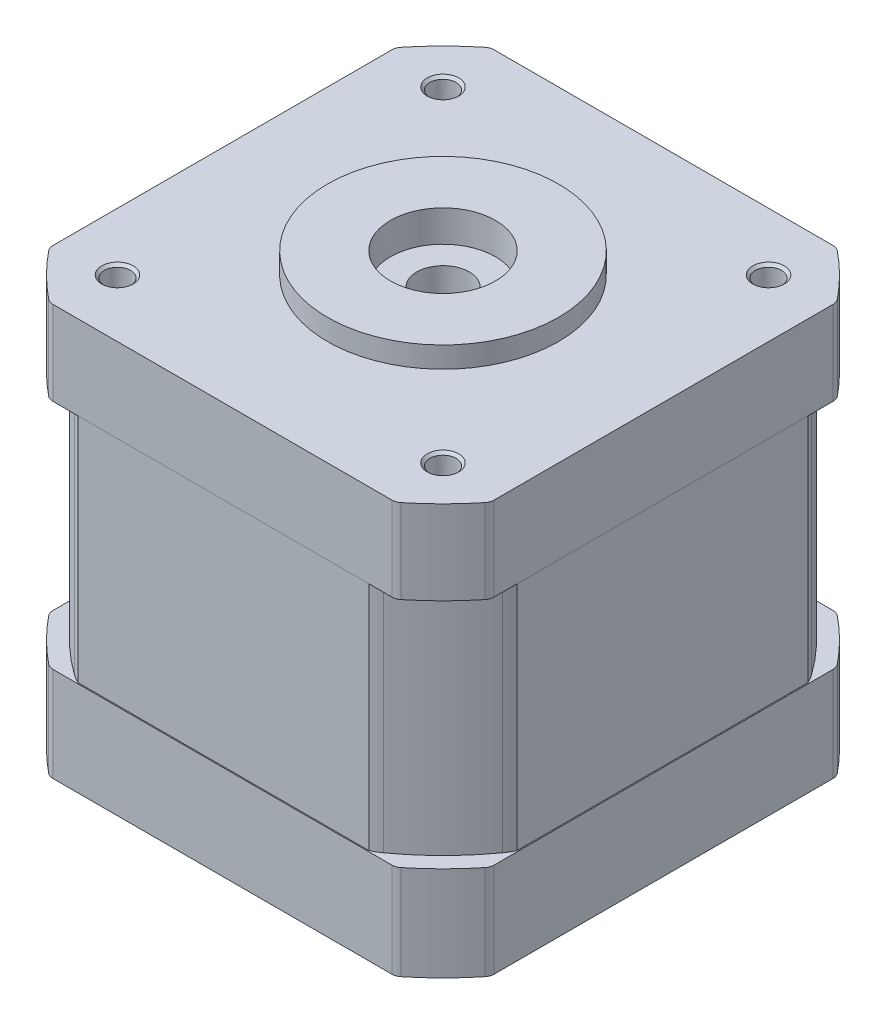
from build123d import *

# Parameters (mm, degrees)
SKETCH2_W          = 55
SKETCH2_H          = 55
SKETCH2_W_2        = 42
SKETCH2_H_2        = 42
CUT_EXTRUDE1_DEPTH = 55.356140408
SKETCH3_W          = 0.1
SKETCH3_H          = 27.678330874
SKETCH3_W_2        = 27.678330874
SKETCH3_H_2        = 0.1
CUT_EXTRUDE2_DEPTH = 22.1
FILLET9_R          = 5
FILLET10_R         = 1
SKETCH4_R          = 1.25
CUT_EXTRUDE3_DEPTH = 6
CHAMFER1_SIZE      = 0.25


with BuildPart() as part:
    # Sketch1 → Revolve1 (revolve)
    with BuildSketch(Plane.XY, mode=Mode.PRIVATE) as revolve1_sk:
        Polygon((5, 0), (11, 0), (11, -2), (26.7, -2), (26.7, -10), (25.15, -10), (25.15, -32.1), (26.7, -32.1), (26.7, -41.1), (5, -41.1), (5, -38.1), (2.5, -38.1), (2.5, -32.1), (11, -32.1), (11, -10), (2.5, -10), (2.5, -3), (5, -3), align=None)
    revolve(revolve1_sk.sketch.rotate(Axis((0, 0, 0), (0, -1, 0)), 180), axis=Axis((0, 0, 0), (0, -1, 0)))

    # Sketch2 → Cut-Extrude1 (cut, through all)
    with BuildSketch(Plane(origin=(0, -2, 0), x_dir=(1, 0, 0), z_dir=(0, 1, 0))):
        Rectangle(SKETCH2_W, SKETCH2_H)
        Rectangle(SKETCH2_W_2, SKETCH2_H_2, mode=Mode.SUBTRACT)
    extrude(amount=-CUT_EXTRUDE1_DEPTH, mode=Mode.SUBTRACT)

    # Sketch3 → Cut-Extrude2 (cut)
    with BuildSketch(Plane.XZ.offset(10)):
        with Locations((-20.95, 0)):
            Rectangle(SKETCH3_W, SKETCH3_H)
        with Locations((0, -20.95)):
            Rectangle(SKETCH3_W_2, SKETCH3_H_2)
        with Locations((20.95, 0)):
            Rectangle(SKETCH3_W, SKETCH3_H)
        with Locations((0, 20.95)):
            Rectangle(SKETCH3_W_2, SKETCH3_H_2)
    extrude(amount=CUT_EXTRUDE2_DEPTH, mode=Mode.SUBTRACT)

    # Fillet9
    # the kernel refuses this fillet: 5 mm, written as the material it takes off along each edge
    with BuildSketch(Plane(origin=(13.839165437, -10, -21), x_dir=(0.8230603738236033, 0, 0.5679538898901478), z_dir=(0, -1, 0)), Plane(origin=(21, -10, 13.839165437), x_dir=(-0.5679538898901461, 0, 0.8230603738236048), z_dir=(0, -1, 0)), Plane(origin=(-13.839165437, -10, 21), x_dir=(-0.8230603738236049, 0, -0.5679538898901455), z_dir=(0, -1, 0)), Plane(origin=(-21, -10, -13.839165437), x_dir=(0.567953889890148, 0, -0.8230603738236033), z_dir=(0, -1, 0))) as fillet9_piece_1:
        with BuildLine():
            CenterArc((0.966453452, 4.998861967), FILLET9_R, 259.51770896, 11.704761359)
            Line((0.056795389, 0.082306037), (0, 0))
            ThreePointArc((0, 0), (0.536563009, -0.005724307), (1.073126019, 0))
        make_face()
    extrude(amount=22.1, mode=Mode.SUBTRACT)
    with BuildSketch(Plane(origin=(21, -10, -13.839165437), x_dir=(-0.5679538898901492, 0, -0.8230603738236025), z_dir=(0, -1, 0)), Plane(origin=(13.839165437, -10, 21), x_dir=(0.8230603738236021, 0, -0.5679538898901498), z_dir=(0, -1, 0)), Plane(origin=(-21, -10, 13.839165437), x_dir=(0.5679538898901505, 0, 0.8230603738236016), z_dir=(0, -1, 0)), Plane(origin=(-13.839165437, -10, -21), x_dir=(-0.8230603738236021, 0, 0.5679538898901498), z_dir=(0, -1, 0))) as fillet9_piece_2:
        with BuildLine():
            CenterArc((0.966453452, -4.998861967), FILLET9_R, 88.777529681, 11.704761359)
            Line((0.056795389, -0.082306037), (0, 0))
            ThreePointArc((0, 0), (0.536563009, 0.005724307), (1.073126019, 0))
        make_face()
    extrude(amount=22.1, mode=Mode.SUBTRACT)

    # Fillet10
    fillet10_edges = [part.edges().sort_by_distance(p)[0] for p in [
        (21, -36.6, -16.4890873),
        (21, -6, -16.4890873),
        (16.4890873, -36.6, 21),
        (16.4890873, -6, 21),
        (-21, -36.6, 16.4890873),
        (-21, -6, 16.4890873),
        (-16.4890873, -36.6, -21),
        (-16.4890873, -6, -21),
        (21, -36.6, 16.4890873),
        (21, -6, 16.4890873),
        (-16.4890873, -36.6, 21),
        (-16.4890873, -6, 21),
        (-21, -36.6, -16.4890873),
        (-21, -6, -16.4890873),
        (16.4890873, -36.6, -21),
        (16.4890873, -6, -21),
    ]]
    fillet(fillet10_edges, radius=FILLET10_R)

    # Sketch4 → Cut-Extrude3 (cut)
    with BuildSketch(Plane(origin=(0, -2, 0), x_dir=(1, 0, 0), z_dir=(0, 1, 0))):
        with Locations(Location((-15.5, 15.5, 0), (0, 0, 180))):
            Circle(SKETCH4_R)
        with Locations(Location((15.5, 15.5, 0), (0, 0, 180))):
            Circle(SKETCH4_R)
        with Locations(Location((15.5, -15.5, 0), (0, 0, 180))):
            Circle(SKETCH4_R)
        with Locations(Location((-15.5, -15.5, 0), (0, 0, 180))):
            Circle(SKETCH4_R)
    extrude(amount=-CUT_EXTRUDE3_DEPTH, mode=Mode.SUBTRACT)

    # Chamfer1
    chamfer1_edges = [part.edges().sort_by_distance(p)[0] for p in [
        (-14.25, -2, -15.5),
        (16.75, -2, -15.5),
        (16.75, -2, 15.5),
        (-14.25, -2, 15.5),
    ]]
    chamfer(chamfer1_edges, length=CHAMFER1_SIZE)


solid = part.part
